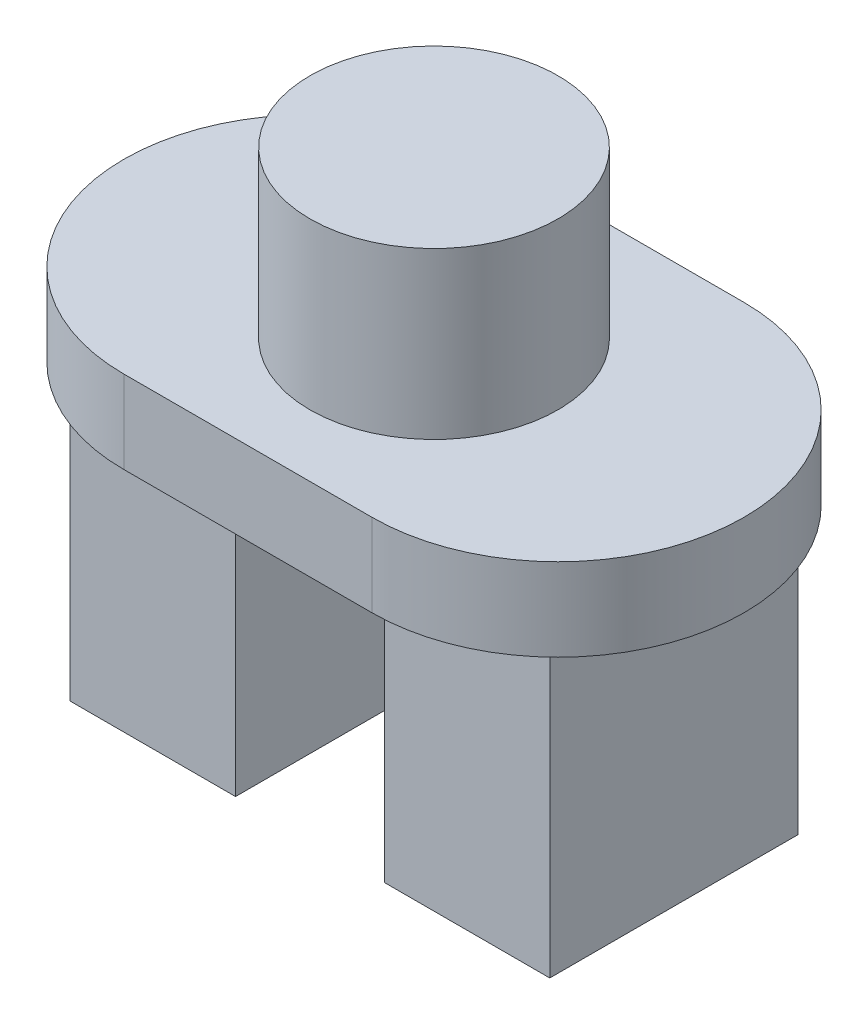
from build123d import *

# Parameters (mm, degrees)
EXTRUDE_1_DEPTH = 1
SKETCH_4_4_R    = 1.5
EXTRUDE_2_DEPTH = 3
EXTRUDE_3_DEPTH = 3.5


with BuildPart() as part:
    # 4段滑动开关草图 → 凸台-拉伸1 (new body)
    with BuildSketch(Plane(origin=(0, 0, 0), x_dir=(1, 0, 0), z_dir=(0, 1, 0))):
        with BuildLine():
            Line((-1.5, -2.25), (1.5, -2.25))
            ThreePointArc((1.5, -2.25), (3.75, 0), (1.5, 2.25))
            Line((1.5, 2.25), (-1.5, 2.25))
            ThreePointArc((-1.5, 2.25), (-3.75, 0), (-1.5, -2.25))
        make_face()
    extrude(amount=EXTRUDE_1_DEPTH)

    # 4段滑动开关草图<4> → 凸台-拉伸2 (add)
    with BuildSketch(Plane(origin=(0, 0, 0), x_dir=(1, 0, 0), z_dir=(0, 1, 0))):
        Circle(SKETCH_4_4_R)
    extrude(amount=EXTRUDE_2_DEPTH)

    # 4段滑动开关草图<5> → 凸台-拉伸3 (add)
    with BuildSketch(Plane(origin=(0, 0, 0), x_dir=(1, 0, 0), z_dir=(0, 1, 0))):
        Polygon((-0.9, 0), (-0.9, 1.5), (-2.9, 1.5), (-2.9, -1.5), (-0.9, -1.5), align=None)
        Polygon((0.9, 0.006077706), (0.9, 1.5), (2.9, 1.5), (2.9, -1.5), (0.9, -1.5), align=None)
    extrude(amount=-EXTRUDE_3_DEPTH)


solid = part.part
